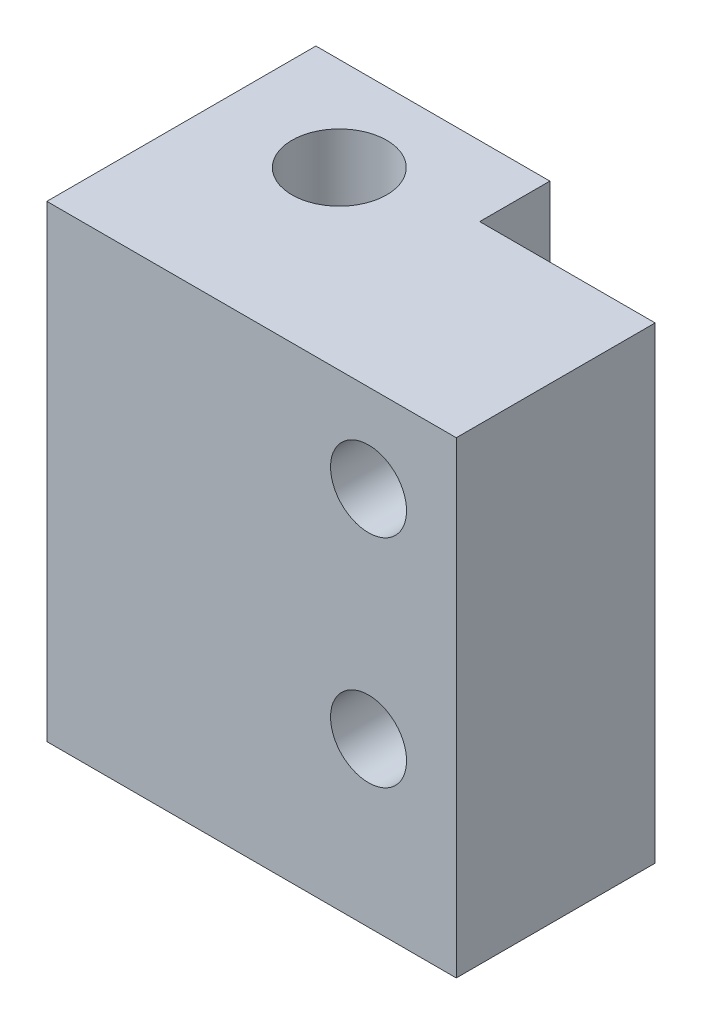
from build123d import *

# Parameters (mm, degrees)
BOSS_EXTRUDE2_DEPTH = 40
SKETCH3_R           = 4.05
CUT_EXTRUDE1_DEPTH  = 35
CUT_EXTRUDE2_REACH  = 52.14
SKETCH4_R           = 3.25
SKETCH6_R           = 1.5
CUT_EXTRUDE3_DEPTH  = 10


with BuildPart() as part:
    # Sketch1 → Boss-Extrude2 (new body)
    with BuildSketch(Plane(origin=(0, 0, 0), x_dir=(1, 0, 0), z_dir=(0, 1, 0))):
        Polygon((-10, -5.257459708), (-10, 0.742540292), (10, 0.742540292), (10, -5.257459708), (25, -5.257459708), (25, -22.257459708), (-10, -22.257459708), align=None)
    extrude(amount=BOSS_EXTRUDE2_DEPTH)

    # Sketch3 → Cut-Extrude1 (cut)
    with BuildSketch(Plane.XZ):
        with Locations((0, 7.257459708)):
            Circle(SKETCH3_R)
    extrude(amount=-CUT_EXTRUDE1_DEPTH, mode=Mode.SUBTRACT)

    # Sketch4 → Cut-Extrude2 (cut, up to next)
    with BuildSketch(Plane(origin=(0, 0, 5.257459708), x_dir=(-1, 0, 0), z_dir=(0, 0, -1)), mode=Mode.PRIVATE) as cut_extrude2_sk1:
        with Locations((-17.5, 26.045770547)):
            Circle(SKETCH4_R)
    cut_extrude2_tool1 = extrude(cut_extrude2_sk1.sketch, amount=-CUT_EXTRUDE2_REACH, mode=Mode.PRIVATE) & part.part
    # Sketch4 → Cut-Extrude2 (cut, up to next)
    with BuildSketch(Plane(origin=(0, 0, 5.257459708), x_dir=(-1, 0, 0), z_dir=(0, 0, -1)), mode=Mode.PRIVATE) as cut_extrude2_sk2:
        with Locations((-17.5, 7.535290978)):
            Circle(SKETCH4_R)
    cut_extrude2_tool2 = extrude(cut_extrude2_sk2.sketch, amount=-CUT_EXTRUDE2_REACH, mode=Mode.PRIVATE) & part.part
    add(cut_extrude2_tool1.solids().sort_by_distance((17.5, 26.045771, 5.25746))[0], mode=Mode.SUBTRACT)
    add(cut_extrude2_tool2.solids().sort_by_distance((17.5, 7.535291, 5.25746))[0], mode=Mode.SUBTRACT)

    # Sketch6 → Cut-Extrude3 (cut)
    with BuildSketch(Plane.XZ.offset(-35)):
        with Locations((0, 7.257459708)):
            Circle(SKETCH6_R)
    extrude(amount=-CUT_EXTRUDE3_DEPTH, mode=Mode.SUBTRACT)


with BuildPart() as body_2:
    # Mirror4: mirrored copy
    add(part.part.mirror(Plane.ZX))


solid = body_2.part
